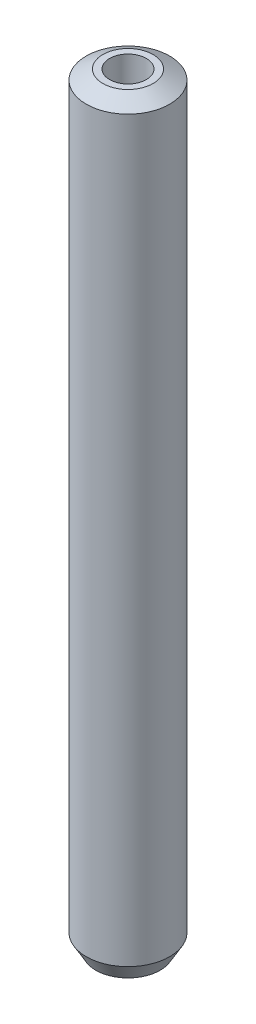
from build123d import *
from OCP.BRepFilletAPI import BRepFilletAPI_MakeChamfer

# Parameters (mm, degrees)
SKETCH1_R           = 17.5
BOSS_EXTRUDE1_DEPTH = 320.467732866
SKETCH2_R           = 7.706545682
CUT_EXTRUDE1_DEPTH  = 322.421946681
CHAMFER1_SIZE       = 4.020356626
CHAMFER1_SIZE2      = 6.963461941


with BuildPart() as part:
    # Sketch1 → Boss-Extrude1 (new body)
    with BuildSketch(Plane(origin=(0, 0, 0), x_dir=(1, 0, 0), z_dir=(0, 1, 0))):
        Circle(SKETCH1_R)
    extrude(amount=BOSS_EXTRUDE1_DEPTH)

    # Sketch2 → Cut-Extrude1 (cut, through all)
    with BuildSketch(Plane(origin=(0, 0, 0), x_dir=(1, 0, 0), z_dir=(0, 1, 0))):
        Circle(SKETCH2_R)
    extrude(amount=CUT_EXTRUDE1_DEPTH, mode=Mode.SUBTRACT)

    # Chamfer1: one chamfer whose edges measure the first distance from different faces: ONE call of the kernel's chamfer builder (chamfer() names one face for all edges)
    chamfer1_edges_1 = [part.edges().sort_by_distance(p)[0] for p in [
        (-17.5, 320.467732866, 0),
    ]]
    chamfer1_side_1 = [part.faces().sort_by_distance(p)[0] for p in [
        (-17.5, 160.233866433, 0),
    ]]
    chamfer1_edges_2 = [part.edges().sort_by_distance(p)[0] for p in [
        (-17.5, 0, 0),
    ]]
    chamfer1_side_2 = [part.faces().sort_by_distance(p)[0] for p in [
        (-17.005025253, 0, 0),
    ]]
    chamfer1 = BRepFilletAPI_MakeChamfer(part.part.solid().wrapped)
    for e in chamfer1_edges_1:
        chamfer1.Add(CHAMFER1_SIZE, CHAMFER1_SIZE2, e.wrapped, chamfer1_side_1[0].wrapped)  # the first distance lies on this face
    for e in chamfer1_edges_2:
        chamfer1.Add(CHAMFER1_SIZE, CHAMFER1_SIZE2, e.wrapped, chamfer1_side_2[0].wrapped)  # the first distance lies on this face
    add(Compound.cast(chamfer1.Shape()), mode=Mode.REPLACE)


solid = part.part
